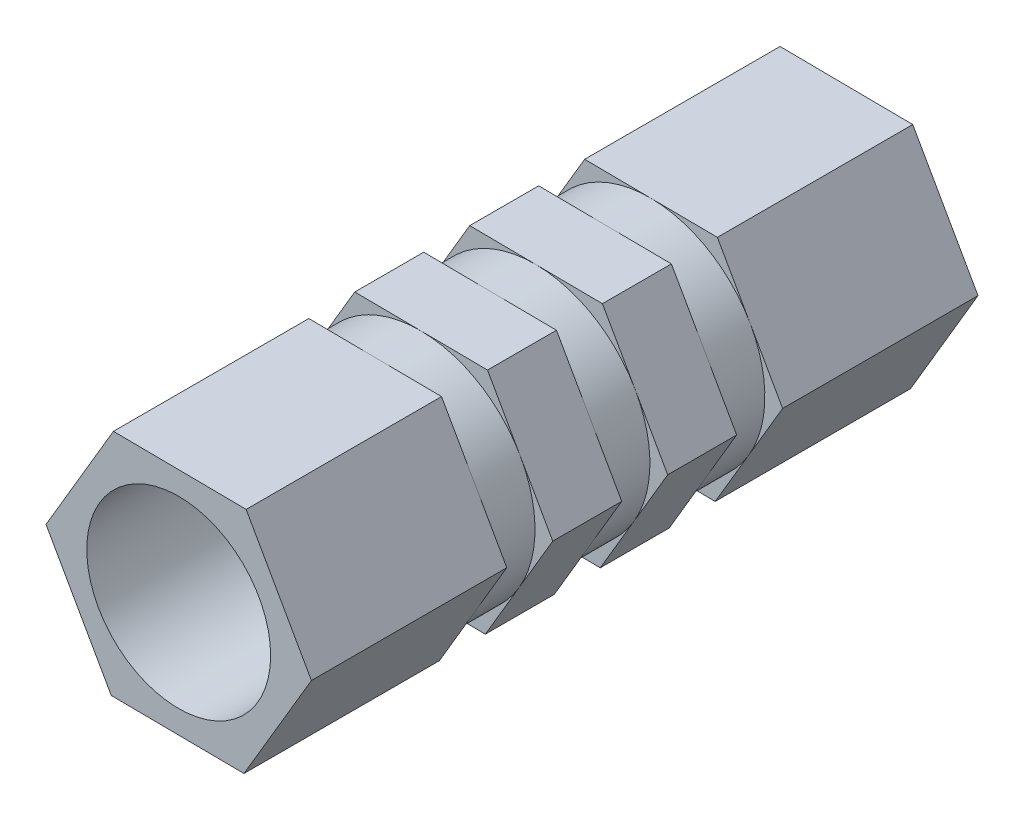
from build123d import *

# Parameters (mm, degrees)
SKETCH1_R           = 2
BOSS_EXTRUDE1_DEPTH = 4.25
SKETCH2_R           = 2
BOSS_EXTRUDE2_DEPTH = 1
SKETCH3_R           = 2
BOSS_EXTRUDE3_DEPTH = 1.5
SKETCH4_R           = 2
BOSS_EXTRUDE4_DEPTH = 1
SKETCH5_R           = 2
BOSS_EXTRUDE5_DEPTH = 1.5
SKETCH6_R           = 2
BOSS_EXTRUDE6_DEPTH = 1
SKETCH7_R           = 2
BOSS_EXTRUDE7_DEPTH = 4.25


with BuildPart() as part:
    # Sketch1 → Boss-Extrude1 (new body)
    with BuildSketch(Plane.XY):
        Polygon((1.466994311, 2.486214195), (-1.419627497, 2.513561438), (-2.886621808, 0.027347243), (-1.466994311, -2.486214195), (1.419627497, -2.513561438), (2.886621808, -0.027347243), align=None)
        Circle(SKETCH1_R, mode=Mode.SUBTRACT)
    extrude(amount=BOSS_EXTRUDE1_DEPTH)

    # Sketch2 → Boss-Extrude2 (add)
    with BuildSketch(Plane.XY.offset(4.25)):
        with BuildLine():
            ThreePointArc((2.176808219, 1.229433193), (1.270454339, 2.153124653), (0.023683079, 2.49988782))
            ThreePointArc((0.023683079, 2.49988782), (-1.229433763, 2.176807898), (-2.15312482, 1.270454056))
            ThreePointArc((-2.15312482, 1.270454056), (-2.499887817, 0.023683402), (-2.176808217, -1.229433198))
            ThreePointArc((-2.176808217, -1.229433198), (-1.270454344, -2.15312465), (-0.023683096, -2.49988782))
            ThreePointArc((-0.023683096, -2.49988782), (1.229433753, -2.176807903), (2.153124817, -1.270454061))
            ThreePointArc((2.153124817, -1.270454061), (2.411722625, -0.658478533), (2.5, 0))
            ThreePointArc((2.5, 0), (2.417852409, 0.635601861), (2.176808219, 1.229433193))
        make_face()
        Circle(SKETCH2_R, mode=Mode.SUBTRACT)
    extrude(amount=BOSS_EXTRUDE2_DEPTH)

    # Sketch3 → Boss-Extrude3 (add)
    with BuildSketch(Plane.XY.offset(5.25)):
        Polygon((1.466994311, 2.486214195), (-1.419627497, 2.513561438), (-2.886621808, 0.027347243), (-1.466994311, -2.486214195), (1.419627497, -2.513561438), (2.886621808, -0.027347243), align=None)
        Circle(SKETCH3_R, mode=Mode.SUBTRACT)
    extrude(amount=BOSS_EXTRUDE3_DEPTH)

    # Sketch4 → Boss-Extrude4 (add)
    with BuildSketch(Plane.XY.offset(6.75)):
        with BuildLine():
            ThreePointArc((2.176808219, 1.229433195), (1.270454339, 2.153124653), (0.023683079, 2.49988782))
            ThreePointArc((0.023683079, 2.49988782), (-1.229433763, 2.176807898), (-2.15312482, 1.270454056))
            ThreePointArc((-2.15312482, 1.270454056), (-2.499887817, 0.023683404), (-2.176808219, -1.229433193))
            ThreePointArc((-2.176808219, -1.229433193), (-1.270454346, -2.153124649), (-0.023683096, -2.49988782))
            ThreePointArc((-0.023683096, -2.49988782), (1.229433751, -2.176807904), (2.153124815, -1.270454065))
            ThreePointArc((2.153124815, -1.270454065), (2.411722625, -0.658478535), (2.5, 0))
            ThreePointArc((2.5, 0), (2.417852409, 0.635601862), (2.176808219, 1.229433195))
        make_face()
        Circle(SKETCH4_R, mode=Mode.SUBTRACT)
    extrude(amount=BOSS_EXTRUDE4_DEPTH)

    # Sketch5 → Boss-Extrude5 (add)
    with BuildSketch(Plane.XY.offset(7.75)):
        Polygon((1.466994311, 2.486214195), (-1.419627497, 2.513561438), (-2.886621808, 0.027347243), (-1.466994311, -2.486214195), (1.419627497, -2.513561438), (2.886621808, -0.027347243), align=None)
        Circle(SKETCH5_R, mode=Mode.SUBTRACT)
    extrude(amount=BOSS_EXTRUDE5_DEPTH)

    # Sketch6 → Boss-Extrude6 (add)
    with BuildSketch(Plane.XY.offset(9.25)):
        with BuildLine():
            ThreePointArc((2.176808219, 1.229433195), (1.270454339, 2.153124653), (0.023683079, 2.49988782))
            ThreePointArc((0.023683079, 2.49988782), (-1.229433762, 2.176807898), (-2.15312482, 1.270454057))
            ThreePointArc((-2.15312482, 1.270454057), (-2.499887817, 0.023683404), (-2.176808219, -1.229433195))
            ThreePointArc((-2.176808219, -1.229433195), (-1.270454346, -2.153124649), (-0.023683096, -2.49988782))
            ThreePointArc((-0.023683096, -2.49988782), (1.229433751, -2.176807904), (2.153124815, -1.270454065))
            ThreePointArc((2.153124815, -1.270454065), (2.411722625, -0.658478535), (2.5, 0))
            ThreePointArc((2.5, 0), (2.417852409, 0.635601862), (2.176808219, 1.229433195))
        make_face()
        Circle(SKETCH6_R, mode=Mode.SUBTRACT)
    extrude(amount=BOSS_EXTRUDE6_DEPTH)

    # Sketch7 → Boss-Extrude7 (add)
    with BuildSketch(Plane.XY.offset(10.25)):
        Polygon((1.466994311, 2.486214195), (-1.419627497, 2.513561438), (-2.886621808, 0.027347243), (-1.466994311, -2.486214195), (1.419627497, -2.513561438), (2.886621808, -0.027347243), align=None)
        Circle(SKETCH7_R, mode=Mode.SUBTRACT)
    extrude(amount=BOSS_EXTRUDE7_DEPTH)


solid = part.part
